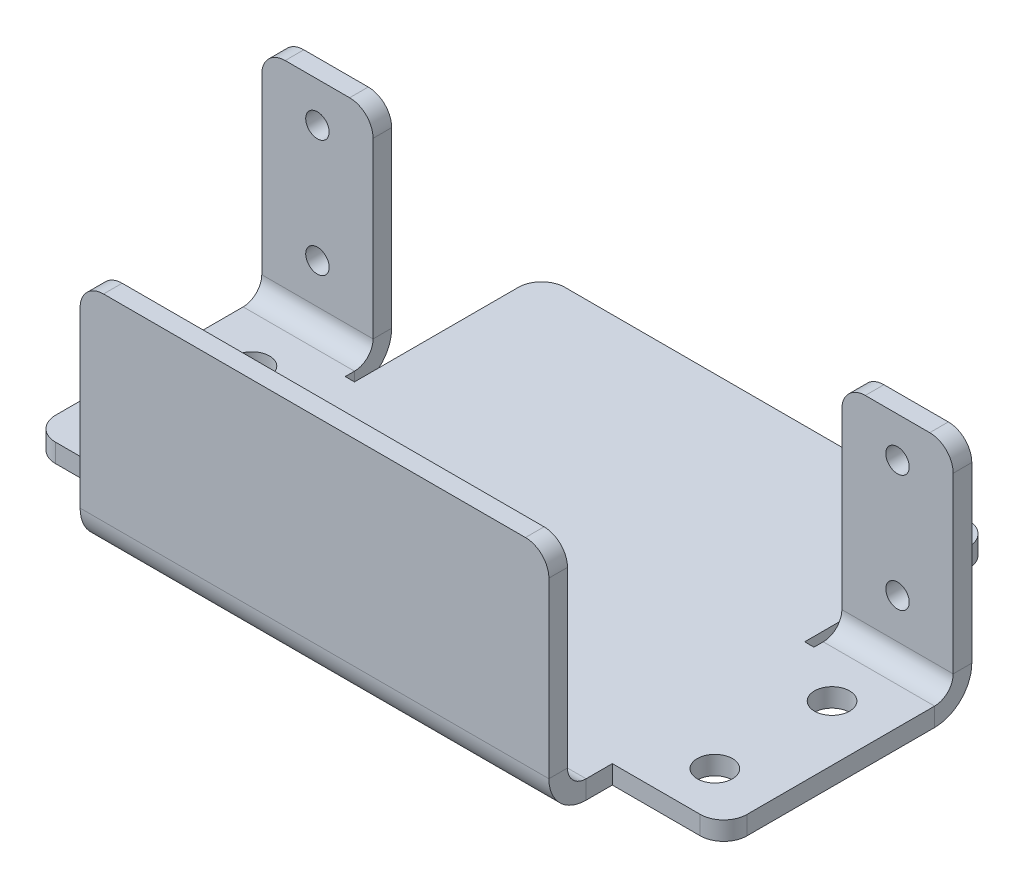
from build123d import *

# Parameters (mm, degrees)
SKETCH2_W                     = 59
SKETCH2_H                     = 25
BOSS_EXTRUDE1_DEPTH           = 1.5875
EDGE_FLANGE2_STRIP_W          = 9.525
EDGE_FLANGE2_STRIP_H          = 1.5875
EDGE_FLANGE2_STRIP_CUT_DEPTH  = 9.5
EDGE_FLANGE2_RELIEF_W         = 10.31875
EDGE_FLANGE2_RELIEF_H         = 0.79375
EDGE_FLANGE2_RELIEF_CUT_DEPTH = 1.5875
EDGE_FLANGE2_DEPTH            = 9.5
EDGE_FLANGE3_STRIP_W          = 9.525
EDGE_FLANGE3_STRIP_H          = 1.5875
EDGE_FLANGE3_STRIP_CUT_DEPTH  = 9.5
EDGE_FLANGE3_RELIEF_W         = 10.31875
EDGE_FLANGE3_RELIEF_H         = 0.79375
EDGE_FLANGE3_RELIEF_CUT_DEPTH = 1.5875
EDGE_FLANGE3_DEPTH            = 9.5
CUT_EXTRUDE1_REACH            = 69.127
SKETCH16_R                    = 1
SKETCH18_W                    = 38.4125
SKETCH18_H                    = 12
BOSS_EXTRUDE2_DEPTH           = 1.5875
SKETCH19_R                    = 1.5
SKETCH19_W                    = 9.5
SKETCH19_H                    = 3.825
CUT_EXTRUDE2_DEPTH            = 1.5875
EDGE_FLANGE4_STRIP_W          = 9.525
EDGE_FLANGE4_STRIP_H          = 1.5875
EDGE_FLANGE4_STRIP_CUT_DEPTH  = 40
EDGE_FLANGE4_DEPTH            = 40
FILLET1_R                     = 2


# Sheet-metal steps are written as plain solids
with BuildPart() as part:
    # Sketch2 → Boss-Extrude1 (new body)
    with BuildSketch(Plane(origin=(0, 0, 0), x_dir=(1, 0, 0), z_dir=(0, 1, 0))):
        with Locations((29.5, 12.5)):
            Rectangle(SKETCH2_W, SKETCH2_H)
    extrude(amount=BOSS_EXTRUDE1_DEPTH)

    # Edge-Flange2 strip (across the edge) → Edge-Flange2 strip cut (cut)
    with BuildSketch(Plane(origin=(59, 1.5875, -25), x_dir=(0, 0, 1), z_dir=(-1, 0, 0))):
        with Locations((-1.5875, -0.79375)):
            Rectangle(EDGE_FLANGE2_STRIP_W, EDGE_FLANGE2_STRIP_H)
    extrude(amount=EDGE_FLANGE2_STRIP_CUT_DEPTH, mode=Mode.SUBTRACT)

    # Edge-Flange2 relief (on the sheet) → Edge-Flange2 relief cut (cut)
    with BuildSketch(Plane(origin=(59, 1.5875, -21.825), x_dir=(0, 0, 1), z_dir=(0, 1, 0))):
        with Locations((-4.365625, -9.896875)):
            Rectangle(EDGE_FLANGE2_RELIEF_W, EDGE_FLANGE2_RELIEF_H)
    extrude(amount=-EDGE_FLANGE2_RELIEF_CUT_DEPTH, mode=Mode.SUBTRACT)

    # Edge-Flange2 section (across the edge) → Edge-Flange2 (add)
    with BuildSketch(Plane(origin=(59, 1.5875, -25), x_dir=(0, 0, 1), z_dir=(-1, 0, 0))):
        with BuildLine():
            Line((0, 1.5875), (0, 18.4125))
            Line((0, 18.4125), (1.5875, 18.4125))
            Line((1.5875, 18.4125), (1.5875, 1.5875))
            ThreePointArc((1.5875, 1.5875), (2.052467985, 0.464967985), (3.175, 0))
            Line((3.175, 0), (3.175, -1.5875))
            ThreePointArc((3.175, -1.5875), (0.92993597, -0.65756403), (0, 1.5875))
        make_face()
    extrude(amount=EDGE_FLANGE2_DEPTH)

    # Edge-Flange3 strip (across the edge) → Edge-Flange3 strip cut (cut)
    with BuildSketch(Plane(origin=(9.5, 1.5875, -25), x_dir=(0, 0, 1), z_dir=(-1, 0, 0))):
        with Locations((-1.5875, -0.79375)):
            Rectangle(EDGE_FLANGE3_STRIP_W, EDGE_FLANGE3_STRIP_H)
    extrude(amount=EDGE_FLANGE3_STRIP_CUT_DEPTH, mode=Mode.SUBTRACT)

    # Edge-Flange3 relief (on the sheet) → Edge-Flange3 relief cut (cut)
    with BuildSketch(Plane(origin=(9.5, 1.5875, -21.825), x_dir=(0, 0, 1), z_dir=(0, 1, 0))):
        with Locations((-4.365625, 0.396875)):
            Rectangle(EDGE_FLANGE3_RELIEF_W, EDGE_FLANGE3_RELIEF_H)
    extrude(amount=-EDGE_FLANGE3_RELIEF_CUT_DEPTH, mode=Mode.SUBTRACT)

    # Edge-Flange3 section (across the edge) → Edge-Flange3 (add)
    with BuildSketch(Plane(origin=(9.5, 1.5875, -25), x_dir=(0, 0, 1), z_dir=(-1, 0, 0))):
        with BuildLine():
            Line((0, 1.5875), (0, 18.4125))
            Line((0, 18.4125), (1.5875, 18.4125))
            Line((1.5875, 18.4125), (1.5875, 1.5875))
            ThreePointArc((1.5875, 1.5875), (2.052467985, 0.464967985), (3.175, 0))
            Line((3.175, 0), (3.175, -1.5875))
            ThreePointArc((3.175, -1.5875), (0.92993597, -0.65756403), (0, 1.5875))
        make_face()
    extrude(amount=EDGE_FLANGE3_DEPTH)

    # Sketch16 → Cut-Extrude1 (cut, up to next)
    with BuildSketch(Plane(origin=(0, 0, -25), x_dir=(-1, 0, 0), z_dir=(0, 0, -1)), mode=Mode.PRIVATE) as cut_extrude1_sk1:
        with Locations(Location((-54.25, 16.5875, 0), (0, 0, 90))):
            Circle(SKETCH16_R)
    cut_extrude1_tool1 = extrude(cut_extrude1_sk1.sketch, amount=-CUT_EXTRUDE1_REACH, mode=Mode.PRIVATE) & part.part
    # Sketch16 → Cut-Extrude1 (cut, up to next)
    with BuildSketch(Plane(origin=(0, 0, -25), x_dir=(-1, 0, 0), z_dir=(0, 0, -1)), mode=Mode.PRIVATE) as cut_extrude1_sk2:
        with Locations(Location((-54.25, 6.5875, 0), (0, 0, 90))):
            Circle(SKETCH16_R)
    cut_extrude1_tool2 = extrude(cut_extrude1_sk2.sketch, amount=-CUT_EXTRUDE1_REACH, mode=Mode.PRIVATE) & part.part
    # Sketch16 → Cut-Extrude1 (cut, up to next)
    with BuildSketch(Plane(origin=(0, 0, -25), x_dir=(-1, 0, 0), z_dir=(0, 0, -1)), mode=Mode.PRIVATE) as cut_extrude1_sk3:
        with Locations(Location((-4.75, 6.5875, 0), (0, 0, 270))):
            Circle(SKETCH16_R)
    cut_extrude1_tool3 = extrude(cut_extrude1_sk3.sketch, amount=-CUT_EXTRUDE1_REACH, mode=Mode.PRIVATE) & part.part
    # Sketch16 → Cut-Extrude1 (cut, up to next)
    with BuildSketch(Plane(origin=(0, 0, -25), x_dir=(-1, 0, 0), z_dir=(0, 0, -1)), mode=Mode.PRIVATE) as cut_extrude1_sk4:
        with Locations(Location((-4.75, 16.5875, 0), (0, 0, 270))):
            Circle(SKETCH16_R)
    cut_extrude1_tool4 = extrude(cut_extrude1_sk4.sketch, amount=-CUT_EXTRUDE1_REACH, mode=Mode.PRIVATE) & part.part
    add(cut_extrude1_tool1.solids().sort_by_distance((54.25, 16.5875, -25))[0], mode=Mode.SUBTRACT)
    add(cut_extrude1_tool2.solids().sort_by_distance((54.25, 6.5875, -25))[0], mode=Mode.SUBTRACT)
    add(cut_extrude1_tool3.solids().sort_by_distance((4.75, 6.5875, -25))[0], mode=Mode.SUBTRACT)
    add(cut_extrude1_tool4.solids().sort_by_distance((4.75, 16.5875, -25))[0], mode=Mode.SUBTRACT)

    # Sketch18 → Boss-Extrude2 (add)
    with BuildSketch(Plane(origin=(0, 1.5875, 0), x_dir=(1, 0, 0), z_dir=(0, 1, 0))):
        with Locations((29.5, 31)):
            Rectangle(SKETCH18_W, SKETCH18_H)
    extrude(amount=-BOSS_EXTRUDE2_DEPTH)

    # Sketch19 → Cut-Extrude2 (cut)
    with BuildSketch(Plane(origin=(0, 1.5875, 0), x_dir=(1, 0, 0), z_dir=(0, 1, 0))):
        with Locations(Location((4.75, 17.825, 0), (0, 0, 270))):
            Circle(SKETCH19_R)
        with Locations(Location((4.75, 7.825, 0), (0, 0, 270))):
            Circle(SKETCH19_R)
        with Locations(Location((54.25, 17.825, 0), (0, 0, 90))):
            Circle(SKETCH19_R)
        with Locations(Location((54.25, 7.825, 0), (0, 0, 90))):
            Circle(SKETCH19_R)
        with Locations((54.25, 1.9125)):
            Rectangle(SKETCH19_W, SKETCH19_H)
        with Locations((4.75, 1.9125)):
            Rectangle(SKETCH19_W, SKETCH19_H)
    extrude(amount=-CUT_EXTRUDE2_DEPTH, mode=Mode.SUBTRACT)

    # Edge-Flange4 strip (across the edge) → Edge-Flange4 strip cut (cut)
    with BuildSketch(Plane(origin=(9.5, 1.5875, 0), x_dir=(0, 0, -1), z_dir=(1, 0, 0))):
        with Locations((-3.175, -0.79375)):
            Rectangle(EDGE_FLANGE4_STRIP_W, EDGE_FLANGE4_STRIP_H)
    extrude(amount=EDGE_FLANGE4_STRIP_CUT_DEPTH, mode=Mode.SUBTRACT)

    # Edge-Flange4 section (across the edge) → Edge-Flange4 (add)
    with BuildSketch(Plane(origin=(9.5, 1.5875, 0), x_dir=(0, 0, -1), z_dir=(1, 0, 0))):
        with BuildLine():
            Line((-1.5875, 1.5875), (-1.5875, 18.4125))
            Line((-1.5875, 18.4125), (0, 18.4125))
            Line((0, 18.4125), (0, 1.5875))
            ThreePointArc((0, 1.5875), (0.464967985, 0.464967985), (1.5875, 0))
            Line((1.5875, 0), (1.5875, -1.5875))
            ThreePointArc((1.5875, -1.5875), (-0.65756403, -0.65756403), (-1.5875, 1.5875))
        make_face()
    extrude(amount=EDGE_FLANGE4_DEPTH)

    # Fillet1
    fillet1_edges = [part.edges().sort_by_distance(p)[0] for p in [
        (10.29375, 0.79375, -37),
        (48.70625, 0.79375, -37),
        (0, 0.79375, -3.825),
        (59, 0.79375, -3.825),
        (9.5, 20, 0.79375),
        (49.5, 20, 0.79375),
        (59, 20, -24.20625),
        (49.5, 20, -24.20625),
        (9.5, 20, -24.20625),
        (0, 20, -24.20625),
    ]]
    fillet(fillet1_edges, radius=FILLET1_R)


solid = part.part
